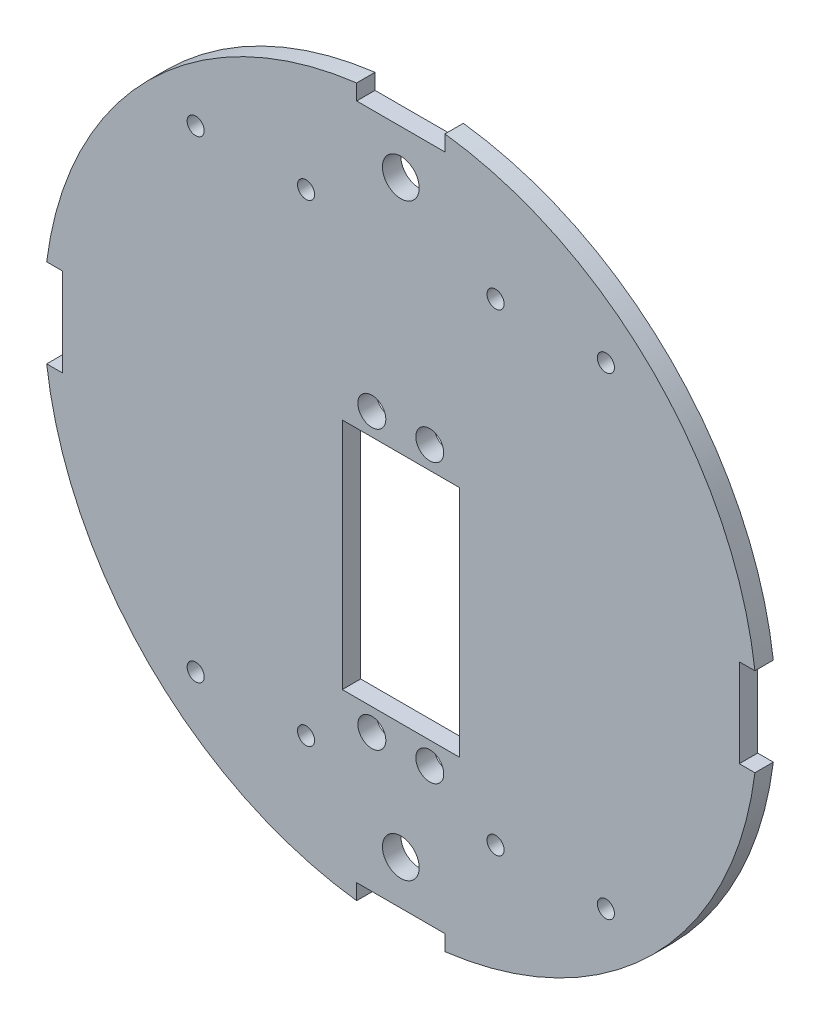
from build123d import *

# Parameters (mm, degrees)
SKETCH1_R           = 61.595
BOSS_EXTRUDE1_DEPTH = 3.175
SKETCH2_R           = 3.175
SKETCH2_W           = 15.24
SKETCH2_H           = 6.35
CUT_EXTRUDE1_DEPTH  = 3.175
CIRPATTERN1_COUNT   = 4
CUT_EXTRUDE2_DEPTH  = 3.175
SKETCH4_R           = 2.413
CUT_EXTRUDE3_DEPTH  = 3.175
BOSS_EXTRUDE2_START = -3.175
SKETCH5_R           = 3.175
BOSS_EXTRUDE2_DEPTH = 3.175
SKETCH6_R           = 1.4732
CUT_EXTRUDE4_DEPTH  = 87.497629303


with BuildPart() as part:
    # Sketch1 → Boss-Extrude1 (new body)
    with BuildSketch(Plane.XY):
        Circle(SKETCH1_R)
    extrude(amount=BOSS_EXTRUDE1_DEPTH)

    # Sketch2 → Cut-Extrude1 (cut)
    with BuildSketch(Plane.XY.offset(3.175)):
        with Locations((0, 50.8)):
            Circle(SKETCH2_R)
        with Locations((0, 61.595)):
            Rectangle(SKETCH2_W, SKETCH2_H)
    cut_extrude1 = extrude(amount=-CUT_EXTRUDE1_DEPTH, mode=Mode.SUBTRACT)

    # CirPattern1: Cut-Extrude1 ×4 about axis
    cirpattern1_axis = Axis((0, 0, 3.175), (0, 0, 1))
    for i in range(1, CIRPATTERN1_COUNT):
        add(cut_extrude1.rotate(cirpattern1_axis, i * 360 / CIRPATTERN1_COUNT), mode=Mode.SUBTRACT)

    # Sketch3 → Cut-Extrude2 (cut)
    with BuildSketch(Plane.XY.offset(3.175)):
        Polygon((-10.1, 9.5), (-10.1, -29.8), (-10.1, -30.8), (-9.1, -30.8), (9.1, -30.8), (10.1, -30.8), (10.1, -29.8), (10.1, 8.5), (10.1, 9.5), align=None)
    extrude(amount=-CUT_EXTRUDE2_DEPTH, mode=Mode.SUBTRACT)

    # Sketch4 → Cut-Extrude3 (cut)
    with BuildSketch(Plane(origin=(0, 0, 0), x_dir=(-1, 0, 0), z_dir=(0, 0, -1))):
        with Locations((5, -34.65)):
            Circle(SKETCH4_R)
        with Locations((-5, -34.65)):
            Circle(SKETCH4_R)
        with Locations((-5, 13.35)):
            Circle(SKETCH4_R)
        with Locations((5, 13.35)):
            Circle(SKETCH4_R)
    extrude(amount=-CUT_EXTRUDE3_DEPTH, mode=Mode.SUBTRACT)

    # Sketch5 → Boss-Extrude2 (add)
    with BuildSketch(Plane(origin=(0, 0, 0), x_dir=(-1, 0, 0), z_dir=(0, 0, -1)).offset(BOSS_EXTRUDE2_START)):
        with Locations((-50.8, 0)):
            Circle(SKETCH5_R)
        with Locations((50.8, 0)):
            Circle(SKETCH5_R)
    extrude(amount=BOSS_EXTRUDE2_DEPTH)

    # Sketch6 → Cut-Extrude4 (cut, through all)
    with BuildSketch(Plane.XY.offset(3.175)):
        with Locations((16.354311186, 40.81189221)):
            Circle(SKETCH6_R)
        with Locations((35.404311186, 40.81189221)):
            Circle(SKETCH6_R)
        with Locations((35.404311186, -40.81189221)):
            Circle(SKETCH6_R)
        with Locations((16.354311186, -40.81189221)):
            Circle(SKETCH6_R)
        with Locations((-16.354311186, -40.81189221)):
            Circle(SKETCH6_R)
        with Locations((-35.404311186, -40.81189221)):
            Circle(SKETCH6_R)
        with Locations((-35.404311186, 40.81189221)):
            Circle(SKETCH6_R)
        with Locations((-16.354311186, 40.81189221)):
            Circle(SKETCH6_R)
    extrude(amount=-CUT_EXTRUDE4_DEPTH, mode=Mode.SUBTRACT)


solid = part.part
